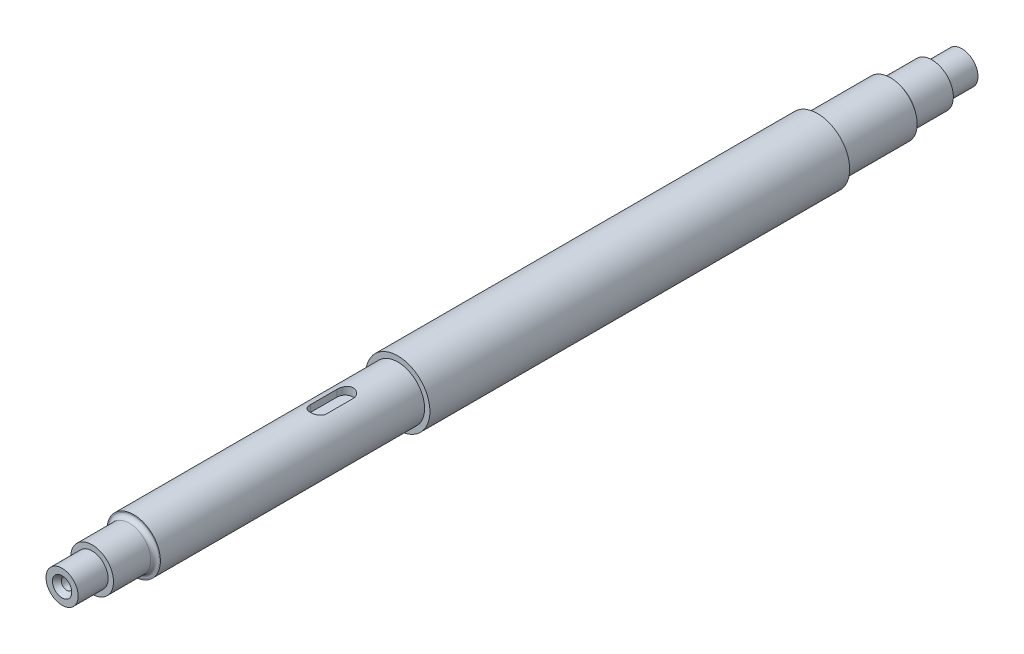
from build123d import *

# Parameters (mm, degrees)
SKETCH1_R            = 9.525
BOSS_EXTRUDE1_DEPTH  = 139.7
CUT_EXTRUDE1_REACH   = 232.645
SKETCH3_R            = 9.525
SKETCH3_R_2          = 7.9375
CUT_EXTRUDE2_REACH   = 266.503
SKETCH4_R            = 7.9375
SKETCH4_R_2          = 4.7625
SKETCH5_R            = 9.525
SKETCH5_R_2          = 7.9375
CUT_EXTRUDE3_DEPTH   = 58.6105
CUT_EXTRUDE4_DEPTH   = 2.38125
SKETCH7_R            = 7.9375
SKETCH7_R_2          = 6.35
CUT_EXTRUDE5_DEPTH   = 12.319
FILLET1_R            = 1.27
SKETCH8_R            = 4.7625
CUT_EXTRUDE6_DEPTH   = 6.35
FILLET1_OF_MIRROR3_R = 1.27
BOSS_EXTRUDE2_START  = 1.905
SKETCH11_R           = 9.525
SKETCH11_R_2         = 7.9375
BOSS_EXTRUDE2_DEPTH  = 1.905


with BuildPart() as part:
    # Sketch1 → Boss-Extrude1 (new, symmetric)
    with BuildSketch(Plane.XY):
        Circle(SKETCH1_R)
    extrude(amount=BOSS_EXTRUDE1_DEPTH, both=True)

    # Sketch3 → Cut-Extrude1 (cut, up to next)
    with BuildSketch(Plane.XY.offset(90.551), mode=Mode.PRIVATE) as cut_extrude1_sk1:
        Circle(SKETCH3_R)
        Circle(SKETCH3_R_2, mode=Mode.SUBTRACT)
    cut_extrude1_tool1 = extrude(cut_extrude1_sk1.sketch, amount=CUT_EXTRUDE1_REACH, mode=Mode.PRIVATE) & part.part
    cut_extrude1 = cut_extrude1_tool1.solids().sort_by_distance((-9.255592, 0, 90.551))[0]
    add(cut_extrude1, mode=Mode.SUBTRACT)

    # Mirror1: Cut-Extrude1 across plane
    add(cut_extrude1.mirror(Plane.XY), mode=Mode.SUBTRACT)

    # Sketch4 → Cut-Extrude2 (cut, up to next)
    with BuildSketch(Plane.XY.offset(124.46), mode=Mode.PRIVATE) as cut_extrude2_sk1:
        Circle(SKETCH4_R)
        Circle(SKETCH4_R_2, mode=Mode.SUBTRACT)
    cut_extrude2_tool1 = extrude(cut_extrude2_sk1.sketch, amount=CUT_EXTRUDE2_REACH, mode=Mode.PRIVATE) & part.part
    cut_extrude2 = cut_extrude2_tool1.solids().sort_by_distance((-7.712994, 0, 124.46))[0]
    add(cut_extrude2, mode=Mode.SUBTRACT)

    # Mirror2: Cut-Extrude2 across plane
    add(cut_extrude2.mirror(Plane.XY), mode=Mode.SUBTRACT)

    # Sketch5 → Cut-Extrude3 (cut)
    with BuildSketch(Plane.XY.offset(90.551)):
        Circle(SKETCH5_R)
        Circle(SKETCH5_R_2, mode=Mode.SUBTRACT)
    extrude(amount=-CUT_EXTRUDE3_DEPTH, mode=Mode.SUBTRACT)

    # Sketch6 → Cut-Extrude4 (cut)
    with BuildSketch(Plane(origin=(0, 7.9375, 0), x_dir=(1, 0, 0), z_dir=(0, 1, 0))):
        with BuildLine():
            Line((-2.38125, -49.43475), (-2.38125, -57.37225))
            ThreePointArc((-2.38125, -57.37225), (0, -59.7535), (2.38125, -57.37225))
            Line((2.38125, -57.37225), (2.38125, -49.43475))
            ThreePointArc((2.38125, -49.43475), (0, -47.0535), (-2.38125, -49.43475))
        make_face()
    extrude(amount=-CUT_EXTRUDE4_DEPTH, mode=Mode.SUBTRACT)

    # Sketch7 → Cut-Extrude5 (cut)
    with BuildSketch(Plane.XY.offset(124.46)):
        Circle(SKETCH7_R)
        Circle(SKETCH7_R_2, mode=Mode.SUBTRACT)
    cut_extrude5 = extrude(amount=-CUT_EXTRUDE5_DEPTH, mode=Mode.SUBTRACT)

    # Fillet1
    fillet1_edges = [part.edges().sort_by_distance(p)[0] for p in [
        (-6.35, 0, 112.141),
    ]]
    fillet(fillet1_edges, radius=FILLET1_R)

    # Sketch8 → Cut-Extrude6 (cut)
    with BuildSketch(Plane.XY.offset(139.7)):
        Circle(SKETCH8_R)
    cut_extrude6 = extrude(amount=-CUT_EXTRUDE6_DEPTH, mode=Mode.SUBTRACT)

    # Sketch10 → CSK for #4 Flat Head Machine Screw1 (revolve, cut)
    with BuildSketch(Plane(origin=(0, 0, 133.35), x_dir=(0, -1, 0), z_dir=(1, 0, 0))):
        Polygon((0, 0), (0, 7.330574487), (1.63195, 6.35), (1.63195, 1.409834001), (2.8575, 0), align=None)
    csk_for_4_flat_head_machine_screw1 = revolve(axis=Axis((0, 0, 139.7), (0, 0, -1)), mode=Mode.SUBTRACT)

    # Mirror3: Cut-Extrude5, Cut-Extrude6, CSK for #4 Flat Head Machine Screw1 across plane
    add(cut_extrude5.mirror(Plane.XY), mode=Mode.SUBTRACT)
    add(cut_extrude6.mirror(Plane.XY), mode=Mode.SUBTRACT)
    add(csk_for_4_flat_head_machine_screw1.mirror(Plane.XY), mode=Mode.SUBTRACT)

    # Fillet1 of Mirror3
    fillet1_of_mirror3_edges = [part.edges().sort_by_distance(p)[0] for p in [
        (-6.35, 0, -112.141),
    ]]
    fillet(fillet1_of_mirror3_edges, radius=FILLET1_OF_MIRROR3_R)

    # Sketch11 → Boss-Extrude2 (add)
    with BuildSketch(Plane.XY.offset(31.9405).offset(BOSS_EXTRUDE2_START)):
        Circle(SKETCH11_R)
        Circle(SKETCH11_R_2, mode=Mode.SUBTRACT)
    extrude(amount=-BOSS_EXTRUDE2_DEPTH)


solid = part.part
